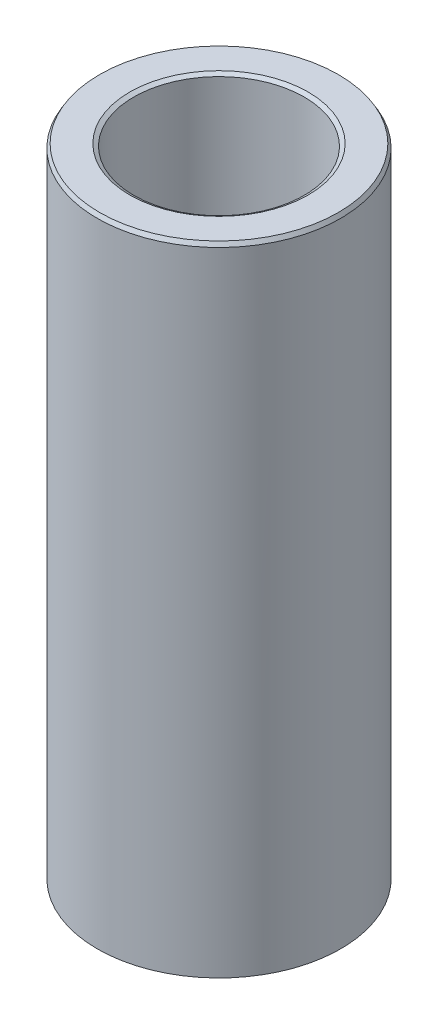
from build123d import *
from OCP.BRepFilletAPI import BRepFilletAPI_MakeChamfer

# Parameters (mm, degrees)
SKETCH1_R           = 57.5
BOSS_EXTRUDE1_DEPTH = 301.80911693
SKETCH2_R           = 40.265062851
CUT_EXTRUDE1_DEPTH  = 313.571980609
CHAMFER1_SIZE       = 1.881562047
CHAMFER1_SIZE2      = 1.086320355


with BuildPart() as part:
    # Sketch1 → Boss-Extrude1 (new body)
    with BuildSketch(Plane(origin=(0, 0, 0), x_dir=(1, 0, 0), z_dir=(0, 1, 0))):
        Circle(SKETCH1_R)
    extrude(amount=BOSS_EXTRUDE1_DEPTH)

    # Sketch2 → Cut-Extrude1 (cut, through all)
    with BuildSketch(Plane(origin=(0, 0, 0), x_dir=(1, 0, 0), z_dir=(0, 1, 0))):
        Circle(SKETCH2_R)
    extrude(amount=CUT_EXTRUDE1_DEPTH, mode=Mode.SUBTRACT)

    # Chamfer1: one chamfer whose edges measure the first distance from different faces: ONE call of the kernel's chamfer builder (chamfer() names one face for all edges)
    chamfer1_edges_1 = [part.edges().sort_by_distance(p)[0] for p in [
        (-40.265062851, 301.80911693, 0),
    ]]
    chamfer1_side_1 = [part.faces().sort_by_distance(p)[0] for p in [
        (-55.873654403, 301.80911693, 0),
    ]]
    chamfer1_edges_2 = [part.edges().sort_by_distance(p)[0] for p in [
        (-40.265062851, 0, 0),
    ]]
    chamfer1_side_2 = [part.faces().sort_by_distance(p)[0] for p in [
        (-40.265062851, 150.904558465, 0),
    ]]
    chamfer1_edges_3 = [part.edges().sort_by_distance(p)[0] for p in [
        (-57.5, 0, 0),
    ]]
    chamfer1_side_3 = [part.faces().sort_by_distance(p)[0] for p in [
        (-55.873654403, 0, 0),
    ]]
    chamfer1_edges_4 = [part.edges().sort_by_distance(p)[0] for p in [
        (-57.5, 301.80911693, 0),
    ]]
    chamfer1_side_4 = [part.faces().sort_by_distance(p)[0] for p in [
        (-57.5, 150.904558465, 0),
    ]]
    chamfer1 = BRepFilletAPI_MakeChamfer(part.part.solid().wrapped)
    for e in chamfer1_edges_1:
        chamfer1.Add(CHAMFER1_SIZE, CHAMFER1_SIZE2, e.wrapped, chamfer1_side_1[0].wrapped)  # the first distance lies on this face
    for e in chamfer1_edges_2:
        chamfer1.Add(CHAMFER1_SIZE, CHAMFER1_SIZE2, e.wrapped, chamfer1_side_2[0].wrapped)  # the first distance lies on this face
    for e in chamfer1_edges_3:
        chamfer1.Add(CHAMFER1_SIZE, CHAMFER1_SIZE2, e.wrapped, chamfer1_side_3[0].wrapped)  # the first distance lies on this face
    for e in chamfer1_edges_4:
        chamfer1.Add(CHAMFER1_SIZE, CHAMFER1_SIZE2, e.wrapped, chamfer1_side_4[0].wrapped)  # the first distance lies on this face
    add(Compound.cast(chamfer1.Shape()), mode=Mode.REPLACE)


solid = part.part
